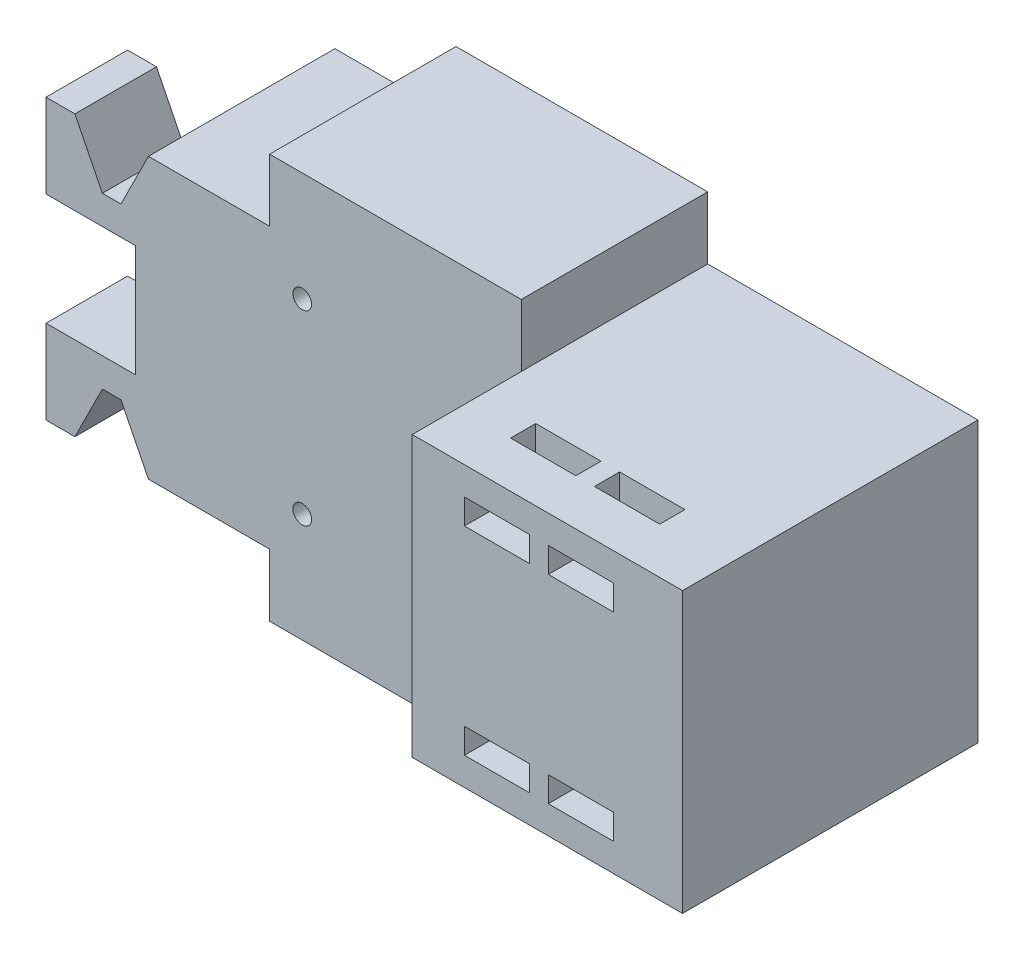
from build123d import *

# Parameters (mm, degrees)
BOSS_EXTRUDE1_DEPTH                  = 20
EARKNOTCH_SKETCH2_W                  = 7.1
EARKNOTCH_SKETCH2_H                  = 30
EARKNOTCH_CUT_EXTRUDE1_DEPTH         = 11.25
TOPHOLES_SKETCH3_R                   = 2.3
TOPHOLES_CUT_EXTRUDE2_DEPTH          = 4
FRONTHOLES_SKETCH1_R                 = 2.25
FRONTHOLES_CUT_EXTRUDE1_DEPTH        = 7
REARMOUNTINGHOLES_SKETCH2_R          = 1
REARMOUNTINGHOLES_CUT_EXTRUDE2_DEPTH = 91.251260933
BLOCKUNDERRAIL_SKETCH1_W             = 29
BLOCKUNDERRAIL_SKETCH1_H             = 30
BLOCKUNDERRAIL_BOSS_EXTRUDE2_DEPTH   = 11.7
REARRIBBONHOLES_SKETCH2_W            = 7
REARRIBBONHOLES_SKETCH2_H            = 2.7
REARRIBBONHOLES_CUT_EXTRUDE1_DEPTH   = 7.65
RIGHTRIBBONHOLES_SKETCH4_W           = 7
RIGHTRIBBONHOLES_SKETCH4_H           = 2.7
RIGHTRIBBONHOLES_CUT_EXTRUDE2_DEPTH  = 5.7
LEFTRIBBONHOLES_SKETCH3_W            = 7
LEFTRIBBONHOLES_SKETCH3_H            = 2.7
LEFTRIBBONHOLES_CUT_EXTRUDE2_DEPTH   = 5.7


with BuildPart() as part:
    # BackFace-Sketch1 → Boss-Extrude1 (new body)
    with BuildSketch(Plane.XY):
        Polygon((0, 0), (0, 9), (9.6, 9), (9.6, 21), (0, 21), (0, 30), (3.1, 30), (6.05, 24.095975949), (8.04, 24.095975949), (10.99, 30), (23.99, 30), (23.99, 36.7), (50.99, 36.7), (50.99, 30), (79.99, 30), (79.99, 0), (50.99, 0), (50.99, -6.7), (23.99, -6.7), (23.99, 0), (10.99, 0), (8.04, 5.904024051), (6.05, 5.904024051), (3.1, 0), align=None)
    extrude(amount=BOSS_EXTRUDE1_DEPTH)

    # EarKnotch-Sketch2 → EarKnotch-Cut-Extrude1 (cut)
    with BuildSketch(Plane(origin=(0, 0, 0), x_dir=(-1, 0, 0), z_dir=(0, 0, -1))):
        with Locations((-3.55, 15)):
            Rectangle(EARKNOTCH_SKETCH2_W, EARKNOTCH_SKETCH2_H)
    extrude(amount=-EARKNOTCH_CUT_EXTRUDE1_DEPTH, mode=Mode.SUBTRACT)

    # TopHoles-Sketch3 → TopHoles-Cut-Extrude2 (cut)
    with BuildSketch(Plane.ZY):
        with Locations((15.5, 25.5)):
            Circle(TOPHOLES_SKETCH3_R)
        with Locations((15.5, 4.5)):
            Circle(TOPHOLES_SKETCH3_R)
    extrude(amount=-TOPHOLES_CUT_EXTRUDE2_DEPTH, mode=Mode.SUBTRACT)

    # FrontHoles-Sketch1 → FrontHoles-Cut-Extrude1 (cut)
    with BuildSketch(Plane(origin=(0, 0, 0), x_dir=(-1, 0, 0), z_dir=(0, 0, -1))):
        with Locations((-55.49, 25)):
            Circle(FRONTHOLES_SKETCH1_R)
        with Locations((-55.49, 5)):
            Circle(FRONTHOLES_SKETCH1_R)
        with Locations((-43.49, 25)):
            Circle(FRONTHOLES_SKETCH1_R)
        with Locations((-43.49, 5)):
            Circle(FRONTHOLES_SKETCH1_R)
    extrude(amount=-FRONTHOLES_CUT_EXTRUDE1_DEPTH, mode=Mode.SUBTRACT)

    # RearMountingHoles-Sketch2 → RearMountingHoles-Cut-Extrude2 (cut, through all)
    with BuildSketch(Plane.XY.offset(20)):
        with Locations((27.49, 25)):
            Circle(REARMOUNTINGHOLES_SKETCH2_R)
        with Locations((27.49, 5)):
            Circle(REARMOUNTINGHOLES_SKETCH2_R)
        with Locations((47.49, 25)):
            Circle(REARMOUNTINGHOLES_SKETCH2_R)
        with Locations((47.49, 5)):
            Circle(REARMOUNTINGHOLES_SKETCH2_R)
    extrude(amount=-REARMOUNTINGHOLES_CUT_EXTRUDE2_DEPTH, mode=Mode.SUBTRACT)

    # BlockUnderRail-Sketch1 → BlockUnderRail-Boss-Extrude2 (add)
    with BuildSketch(Plane.XY.offset(20)):
        with Locations((65.49, 15)):
            Rectangle(BLOCKUNDERRAIL_SKETCH1_W, BLOCKUNDERRAIL_SKETCH1_H)
    extrude(amount=BLOCKUNDERRAIL_BOSS_EXTRUDE2_DEPTH)

    # RearRibbonHoles-Sketch2 → RearRibbonHoles-Cut-Extrude1 (cut)
    with BuildSketch(Plane.XY.offset(31.7)):
        with Locations((60.09, 25.65)):
            Rectangle(REARRIBBONHOLES_SKETCH2_W, REARRIBBONHOLES_SKETCH2_H)
        with Locations((69.09, 25.65)):
            Rectangle(REARRIBBONHOLES_SKETCH2_W, REARRIBBONHOLES_SKETCH2_H)
        with Locations((60.09, 4.35)):
            Rectangle(REARRIBBONHOLES_SKETCH2_W, REARRIBBONHOLES_SKETCH2_H)
        with Locations((69.09, 4.35)):
            Rectangle(REARRIBBONHOLES_SKETCH2_W, REARRIBBONHOLES_SKETCH2_H)
    extrude(amount=-REARRIBBONHOLES_CUT_EXTRUDE1_DEPTH, mode=Mode.SUBTRACT)

    # RightRibbonHoles-Sketch4 → RightRibbonHoles-Cut-Extrude2 (cut)
    with BuildSketch(Plane(origin=(0, 30, 0), x_dir=(1, 0, 0), z_dir=(0, 1, 0))):
        with Locations((60.09, -25.4)):
            Rectangle(RIGHTRIBBONHOLES_SKETCH4_W, RIGHTRIBBONHOLES_SKETCH4_H)
        with Locations((69.09, -25.4)):
            Rectangle(RIGHTRIBBONHOLES_SKETCH4_W, RIGHTRIBBONHOLES_SKETCH4_H)
    extrude(amount=-RIGHTRIBBONHOLES_CUT_EXTRUDE2_DEPTH, mode=Mode.SUBTRACT)

    # LeftRibbonHoles-Sketch3 → LeftRibbonHoles-Cut-Extrude2 (cut)
    with BuildSketch(Plane.XZ):
        with Locations((60.09, 25.4)):
            Rectangle(LEFTRIBBONHOLES_SKETCH3_W, LEFTRIBBONHOLES_SKETCH3_H)
        with Locations((69.09, 25.4)):
            Rectangle(LEFTRIBBONHOLES_SKETCH3_W, LEFTRIBBONHOLES_SKETCH3_H)
    extrude(amount=-LEFTRIBBONHOLES_CUT_EXTRUDE2_DEPTH, mode=Mode.SUBTRACT)


solid = part.part
